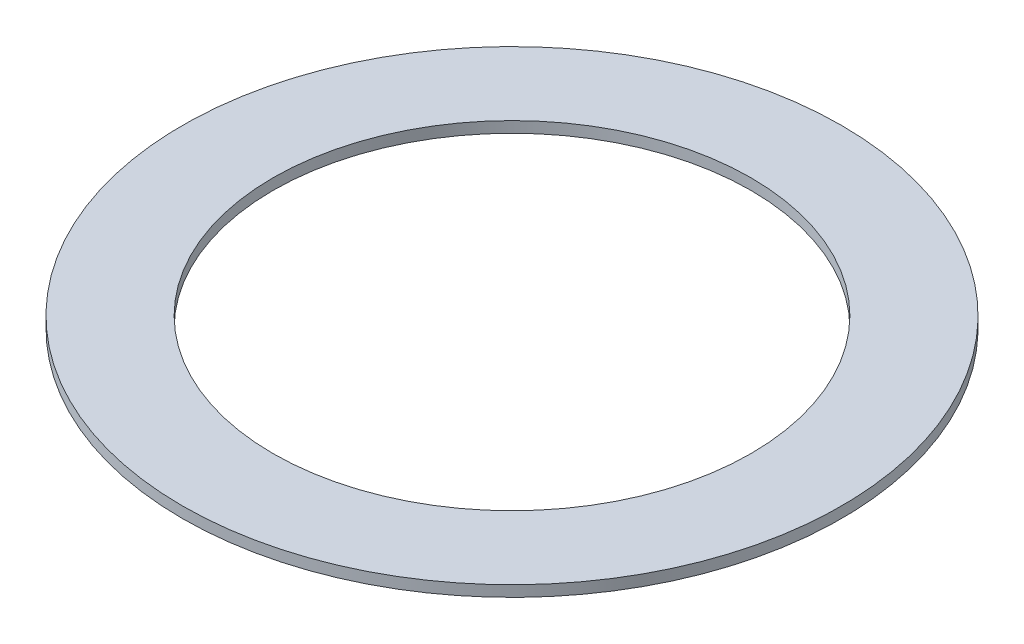
from build123d import *

# Parameters (mm, degrees)
SKETCH1_R           = 60
SKETCH1_R_2         = 43.5
BOSS_EXTRUDE1_DEPTH = 1


with BuildPart() as part:
    # Sketch1 → Boss-Extrude1 (new, symmetric)
    with BuildSketch(Plane(origin=(0, 0, 0), x_dir=(1, 0, 0), z_dir=(0, 1, 0))):
        Circle(SKETCH1_R)
        Circle(SKETCH1_R_2, mode=Mode.SUBTRACT)
    extrude(amount=BOSS_EXTRUDE1_DEPTH, both=True)


solid = part.part
